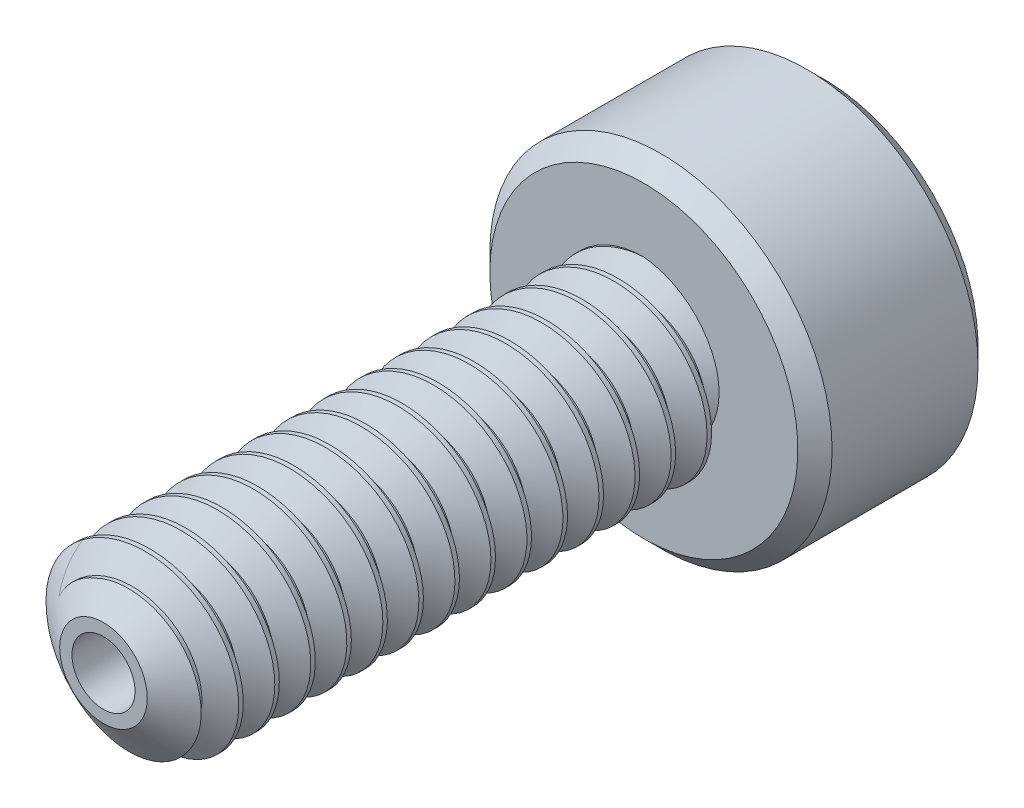
from build123d import *

# Parameters (mm, degrees)
SKETCH1_R          = 1
EXTRUDE1_DEPTH     = 6
CUT_SWEEP1_PITCH   = 0.4
SKETCH6_R          = 1.9
EXTRUDE2_DEPTH     = 2
CUT_EXTRUDE1_DEPTH = 1.125
CHAMFER1_SIZE      = 0.19
SKETCH11_R         = 0.35
CUT_EXTRUDE3_DEPTH = 9.439194274


with BuildPart() as part:
    # Sketch1 → Extrude1 (new body)
    with BuildSketch(Plane.XY):
        Circle(SKETCH1_R)
    extrude(amount=-EXTRUDE1_DEPTH)

    # Cut-Sweep1: the profile of Sketch3 profile screwed along a right-hand helix of 16 turns, 6 arcs to a turn; built about Z, then put on its axis
    cut_sweep1_z = Axis((0, 0, 0), (0, 0, 1))
    cut_sweep1_corners = [(1.0003, 0, -0.350173205), (0.740192379, 0, -0.2), (0.740192379, 0, -0.15), (1.0003, 0, 0.000173205)]
    with BuildLine(mode=Mode.PRIVATE) as cut_sweep1_profile:
        Line(cut_sweep1_corners[0], cut_sweep1_corners[1])
        Line(cut_sweep1_corners[1], cut_sweep1_corners[2])
        Line(cut_sweep1_corners[2], cut_sweep1_corners[3])
        Line(cut_sweep1_corners[3], cut_sweep1_corners[0])
    cut_sweep1_cap = Face(cut_sweep1_profile.wire())
    cut_sweep1_turn_angles = [0, 30, 60, 90, 120, 150, 180, 210, 240, 270, 300, 330, 360]
    cut_sweep1_turn_weights = [1, 0.8660254037844387, 1, 0.8660254037844387, 1, 0.8660254037844387, 1, 0.8660254037844387, 1, 0.8660254037844387, 1, 0.8660254037844387, 1]
    cut_sweep1_turn_rails = [Edge.make_bspline([Vector(p[0], p[1], 0).rotate(cut_sweep1_z, cut_sweep1_turn_angles[k]) / cut_sweep1_turn_weights[k] + Vector(0, 0, p[2] + CUT_SWEEP1_PITCH * cut_sweep1_turn_angles[k] / 360) for k in range(13)], [0, 0, 0, 1, 1, 2, 2, 3, 3, 4, 4, 5, 5, 6, 6, 6], 2, cut_sweep1_turn_weights) for p in cut_sweep1_corners]
    cut_sweep1_turn_sides = [Face.make_surface_from_curves(cut_sweep1_turn_rails[p[0]], cut_sweep1_turn_rails[p[1]]) for p in [(0, 1), (1, 2), (2, 3), (3, 0)]]
    cut_sweep1 = Plane(origin=(0, 0, 0), x_dir=(0, 1, 0), z_dir=(0, 0, -1)) * Solid(Shell([*[p.moved(Location((0, 0, CUT_SWEEP1_PITCH * i))) for i in range(16) for p in cut_sweep1_turn_sides], cut_sweep1_cap, cut_sweep1_cap.rotate(cut_sweep1_z, 5760).moved(Location((0, 0, CUT_SWEEP1_PITCH * 5760 / 360)))]))
    add(cut_sweep1, mode=Mode.SUBTRACT)

    # Sketch4 → Cut-Revolve1 (revolve, cut)
    with BuildSketch(Plane(origin=(0, 0, 0), x_dir=(0, 0, -1), z_dir=(1, 0, 0)), mode=Mode.PRIVATE) as cut_revolve1_sk:
        Polygon((0.35977197, 1), (0, 0.486192379), (0, 1), align=None)
    revolve(cut_revolve1_sk.sketch.rotate(Axis((0, 0, 0), (0, 0, -1)), 278.428757719), axis=Axis((0, 0, 0), (0, 0, -1)), mode=Mode.SUBTRACT)

    # Sketch6 → Extrude2 (add)
    with BuildSketch(Plane(origin=(0, 0, -6), x_dir=(-1, 0, 0), z_dir=(0, 0, -1))):
        Circle(SKETCH6_R)
    extrude(amount=EXTRUDE2_DEPTH)

    # Sketch7 → Cut-Extrude1 (cut)
    with BuildSketch(Plane(origin=(0, 0, -8), x_dir=(-1, 0, 0), z_dir=(0, 0, -1))):
        Polygon((0, 0.866025404), (-0.75, 0.433012702), (-0.75, -0.433012702), (0, -0.866025404), (0.75, -0.433012702), (0.75, 0.433012702), align=None)
    extrude(amount=-CUT_EXTRUDE1_DEPTH, mode=Mode.SUBTRACT)

    # Cut-Extrude2 cone 1 section (through the dimple's axis) → Cut-Extrude2 (revolve, cut)
    with BuildSketch(Plane(origin=(0, 0, -8), x_dir=(0, 1, 0), z_dir=(1, 0, 0))):
        Polygon((0, 0), (0.866025404, 0), (0, 0.866025404), align=None)
    revolve(axis=Axis((0, 0, -8), (0, 0, 1)), mode=Mode.SUBTRACT)

    # Chamfer1
    chamfer1_edges = [part.edges().sort_by_distance(p)[0] for p in [
        (1.9, 0, -6),
        (1.9, 0, -8),
    ]]
    chamfer(chamfer1_edges, length=CHAMFER1_SIZE)

    # Sketch11 → Cut-Extrude3 (cut, through all)
    with BuildSketch(Plane.XY):
        Circle(SKETCH11_R)
    extrude(amount=-CUT_EXTRUDE3_DEPTH, mode=Mode.SUBTRACT)


solid = part.part
